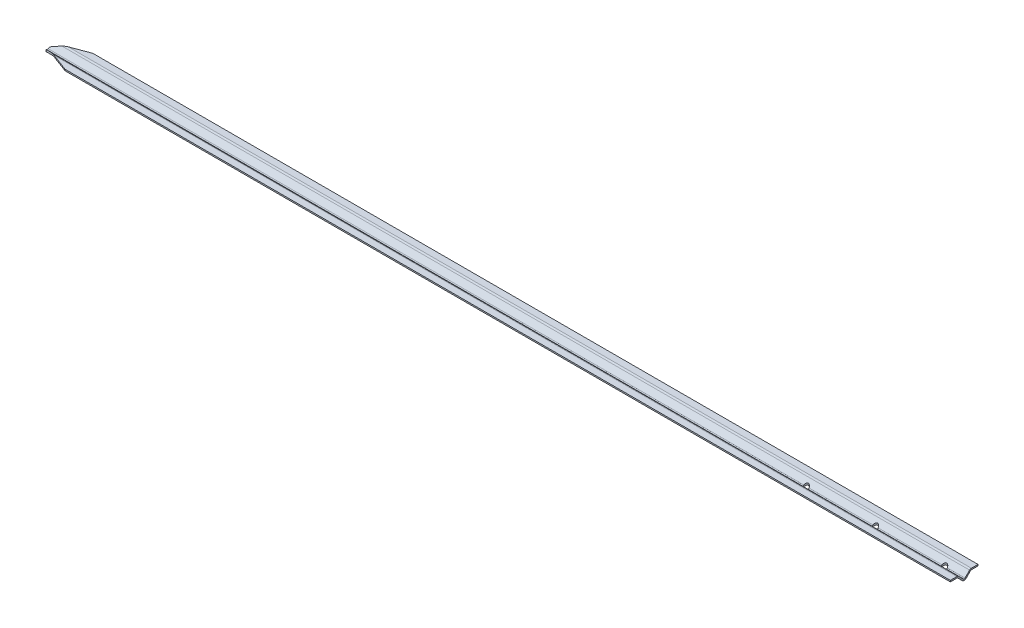
from build123d import *

# Parameters (mm, degrees)
EXTRUDE_1_DEPTH          = 500
CUT_EXTRUDE_1_DEPTH      = 501.272833733
CUT_EXTRUDE_1_DEPTH_BACK = 501.272833733
SKETCH_3_R               = 3
CUT_EXTRUDE_2_DEPTH      = 501.272833834


with BuildPart() as part:
    # Эскиз5 → Бобышка-Вытянуть1 (new, symmetric)
    with BuildSketch(Plane(origin=(0, 0, 0), x_dir=(0, 0, -1), z_dir=(1, 0, 0))):
        with BuildLine():
            Line((-15, -0.75), (-7.828427125, -0.75))
            ThreePointArc((-7.828427125, -0.75), (-7.350072834, -0.845150584), (-6.944543648, -1.116116524))
            Line((-6.944543648, -1.116116524), (-1.944543648, -6.116116524))
            ThreePointArc((-1.944543648, -6.116116524), (0, -6.921572875), (1.944543648, -6.116116524))
            Line((1.944543648, -6.116116524), (6.944543648, -1.116116524))
            ThreePointArc((6.944543648, -1.116116524), (7.350072834, -0.845150584), (7.828427125, -0.75))
            Line((7.828427125, -0.75), (15, -0.75))
            Line((15, -0.75), (15, 0.75))
            Line((15, 0.75), (7.828427125, 0.75))
            ThreePointArc((7.828427125, 0.75), (6.776047686, 0.540668714), (5.883883476, -0.055456352))
            Line((5.883883476, -0.055456352), (0.883883476, -5.055456352))
            ThreePointArc((0.883883476, -5.055456352), (0, -5.421572875), (-0.883883476, -5.055456352))
            Line((-0.883883476, -5.055456352), (-5.883883476, -0.055456352))
            ThreePointArc((-5.883883476, -0.055456352), (-6.776047686, 0.540668714), (-7.828427125, 0.75))
            Line((-7.828427125, 0.75), (-15, 0.75))
            Line((-15, 0.75), (-15, -0.75))
        make_face()
    extrude(amount=EXTRUDE_1_DEPTH, both=True)

    # Эскиз2 → Вырез-Вытянуть1 (cut, two sides: drawn at the far end of the back side and taken through both)
    with BuildSketch(Plane(origin=(0, 0, 0), x_dir=(1, 0, 0), z_dir=(0, 1, 0)).offset(-CUT_EXTRUDE_1_DEPTH_BACK)):
        with BuildLine():
            Line((1347.992907108, -692.997340166), (-460, -15))
            Line((-460, -15), (-492.509366579, -2.808987533))
            ThreePointArc((-492.509366579, -2.808987533), (-494.455996255, 0), (-492.509366579, 2.808987533))
            Line((-492.509366579, 2.808987533), (-460, 15))
            Line((-460, 15), (1347.992907108, 692.997340166))
            Line((1347.992907108, 692.997340166), (-2513.881635352, 692.997340166))
            Line((-2513.881635352, 692.997340166), (-2513.881635352, -692.997340166))
            Line((-2513.881635352, -692.997340166), (1347.992907108, -692.997340166))
        make_face()
    extrude(amount=CUT_EXTRUDE_1_DEPTH + CUT_EXTRUDE_1_DEPTH_BACK, mode=Mode.SUBTRACT)

    # Эскиз3 → Вырез-Вытянуть2 (cut, through all)
    with BuildSketch(Plane(origin=(0, 0, 0), x_dir=(1, 0, 0), z_dir=(0, 1, 0))):
        with Locations((478, 0)):
            Circle(SKETCH_3_R)
        with Locations((328, 0)):
            Circle(SKETCH_3_R)
        with Locations((403, 0)):
            Circle(SKETCH_3_R)
    extrude(amount=-CUT_EXTRUDE_2_DEPTH, mode=Mode.SUBTRACT)


solid = part.part
